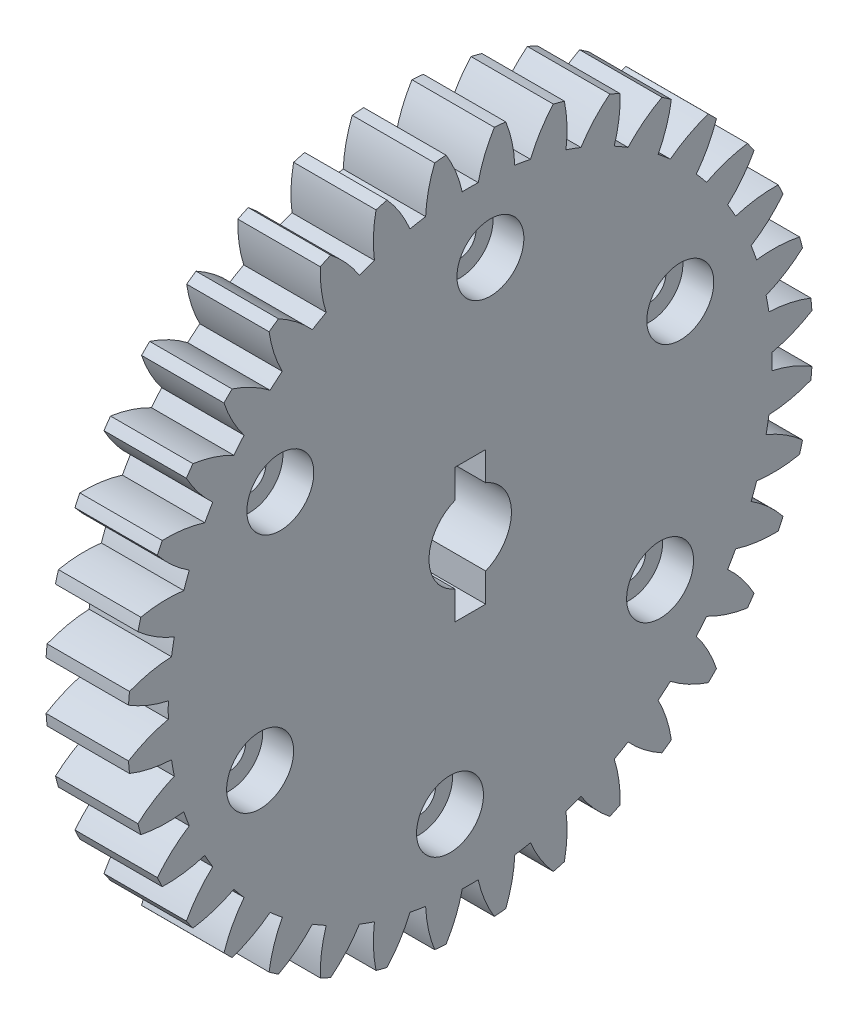
from build123d import *

# Parameters (mm, degrees)
BASPROSKE_W                  = 8
BASPROSKE_H                  = 33.25
TOOTHCUT_DEPTH               = 48.698270409
TEETHCUTS_COUNT              = 36
TEETHCUTS_ANGLE              = 350
BORSKE_R                     = 4
BORE_DEPTH                   = 50.0000508
ESQUISSE2_R                  = 1.6
ENL_V_MAT_EXTRU_2_DEPTH      = 10
ESQUISSE3_R                  = 3.25
ENL_V_MAT_EXTRU_3_DEPTH      = 3
R_P_TITION_CIRCULAIRE1_COUNT = 6
ESQUISSE4_W                  = 3
ESQUISSE4_H                  = 13
ENL_V_MAT_EXTRU_4_DEPTH      = 10


with BuildPart() as part:
    # BasProSke → Base-Revolve (revolve)
    with BuildSketch(Plane(origin=(0, 0, 0), x_dir=(1, 0, 0), z_dir=(0, 1, 0))):
        with Locations((4, 16.625)):
            Rectangle(BASPROSKE_W, BASPROSKE_H)
    revolve(axis=Axis((-10, 0, 0), (1, 0, 0)))

    # TooCutSke → ToothCut (cut, through all)
    with BuildSketch(Plane(origin=(0, 0, 0), x_dir=(0, 0, -1), z_dir=(1, 0, 0))):
        with BuildLine():
            ThreePointArc((0.773836769, 29.3012834), (0, 29.3115), (-0.773836769, 29.3012834))
            ThreePointArc((-0.773836769, 29.3012834), (-1.403294931, 31.313012095), (-2.359315682, 33.19165369))
            ThreePointArc((-2.359315682, 33.19165369), (0, 33.2754), (2.359315682, 33.19165369))
            ThreePointArc((2.359315682, 33.19165369), (1.403294931, 31.313012095), (0.773836769, 29.3012834))
        make_face()
    toothcut = extrude(amount=TOOTHCUT_DEPTH, mode=Mode.SUBTRACT)

    # TeethCuts: ToothCut ×36 about axis
    teethcuts_axis = Axis((-10, 0, 0), (1, 0, 0))
    for i in range(1, TEETHCUTS_COUNT):
        add(toothcut.rotate(teethcuts_axis, i * TEETHCUTS_ANGLE / (TEETHCUTS_COUNT - 1)), mode=Mode.SUBTRACT)

    # BorSke → Bore (cut, symmetric)
    with BuildSketch(Plane(origin=(0, 0, 0), x_dir=(0, 0, -1), z_dir=(1, 0, 0))):
        Circle(BORSKE_R)
    extrude(amount=BORE_DEPTH, both=True, mode=Mode.SUBTRACT)

    # Esquisse2 → Enlèv. mat.-Extru.2 (cut)
    with BuildSketch(Plane(origin=(8, 0, 0), x_dir=(0, 0, -1), z_dir=(1, 0, 0))):
        with Locations((1.961004212, 22.414380707)):
            Circle(ESQUISSE2_R)
    enl_v_mat_extru_2 = extrude(amount=-ENL_V_MAT_EXTRU_2_DEPTH, mode=Mode.SUBTRACT)

    # Esquisse3 → Enlèv. mat.-Extru.3 (cut)
    with BuildSketch(Plane(origin=(8, 0, 0), x_dir=(0, 0, -1), z_dir=(1, 0, 0))):
        with Locations((1.961004212, 22.414380707)):
            Circle(ESQUISSE3_R)
    enl_v_mat_extru_3 = extrude(amount=-ENL_V_MAT_EXTRU_3_DEPTH, mode=Mode.SUBTRACT)

    # Répétition circulaire1: Enlèv. mat.-Extru.2, Enlèv. mat.-Extru.3 ×6 about axis
    r_p_tition_circulaire1_axis = Axis((50.0000508, 0, 0), (-1, 0, 0))
    add([enl_v_mat_extru_2.rotate(r_p_tition_circulaire1_axis, i * 360 / R_P_TITION_CIRCULAIRE1_COUNT) for i in range(1, R_P_TITION_CIRCULAIRE1_COUNT)], mode=Mode.SUBTRACT)
    add([enl_v_mat_extru_3.rotate(r_p_tition_circulaire1_axis, i * 360 / R_P_TITION_CIRCULAIRE1_COUNT) for i in range(1, R_P_TITION_CIRCULAIRE1_COUNT)], mode=Mode.SUBTRACT)

    # Esquisse4 → Enlèv. mat.-Extru.4 (cut)
    with BuildSketch(Plane(origin=(8, 0, 0), x_dir=(0, 0, -1), z_dir=(1, 0, 0))):
        Rectangle(ESQUISSE4_W, ESQUISSE4_H)
    extrude(amount=-ENL_V_MAT_EXTRU_4_DEPTH, mode=Mode.SUBTRACT)


solid = part.part
